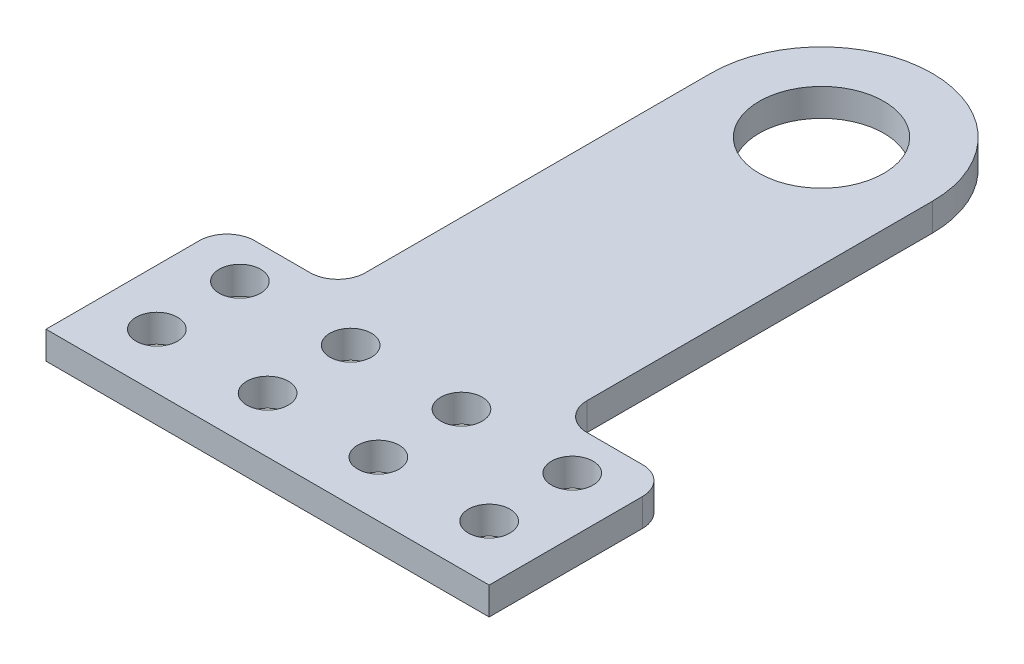
from build123d import *

# Parameters (mm, degrees)
SKETCH1_W            = 25.4
SKETCH1_H            = 41.493412961
SKETCH1_W_2          = 50.8
SKETCH1_H_2          = 110.906587039
BOSS_EXTRUDE1_DEPTH  = 6.35
SKETCH2_R            = 14.3002
CUT_EXTRUDE1_DEPTH   = 6.35
SKETCH3_R            = 4.7625
CUT_EXTRUDE2_DEPTH   = 6.35
LPATTERN1_COUNT      = 4
LPATTERN1_PITCH      = 25.4
LPATTERN1_COUNT_DIR2 = 2
LPATTERN1_PITCH_DIR2 = 19.05
FILLET1_R            = 6.35
FILLET2_R            = 25.4


with BuildPart() as part:
    # Sketch1 → Boss-Extrude1 (new body)
    with BuildSketch(Plane(origin=(0, 0, 0), x_dir=(1, 0, 0), z_dir=(0, 1, 0))):
        with Locations((-38.1, -55.45329352)):
            Rectangle(SKETCH1_W, SKETCH1_H)
        with Locations((0, -55.45329352)):
            Rectangle(SKETCH1_W_2, SKETCH1_H)
        with Locations((0, 20.746706481)):
            Rectangle(SKETCH1_W_2, SKETCH1_H_2)
        with Locations((38.1, -55.45329352)):
            Rectangle(SKETCH1_W, SKETCH1_H)
    extrude(amount=BOSS_EXTRUDE1_DEPTH)

    # Sketch2 → Cut-Extrude1 (cut)
    with BuildSketch(Plane(origin=(0, 6.35, 0), x_dir=(1, 0, 0), z_dir=(0, 1, 0))):
        with Locations(Location((0, 50.8, 0), (0, 0, 270))):
            Circle(SKETCH2_R)
    extrude(amount=-CUT_EXTRUDE1_DEPTH, mode=Mode.SUBTRACT)

    # Sketch3 → Cut-Extrude2 (cut)
    with BuildSketch(Plane(origin=(0, 6.35, 0), x_dir=(1, 0, 0), z_dir=(0, 1, 0))):
        with Locations(Location((-38.1, -63.5, 0), (0, 0, 270))):
            Circle(SKETCH3_R)
    cut_extrude2 = extrude(amount=-CUT_EXTRUDE2_DEPTH, mode=Mode.SUBTRACT)

    # LPattern1: Cut-Extrude2 4 × 2
    with Locations(*[(i * LPATTERN1_PITCH, 0, -j * LPATTERN1_PITCH_DIR2) for i in range(LPATTERN1_COUNT) for j in range(LPATTERN1_COUNT_DIR2) if (i, j) != (0, 0)]):
        add(cut_extrude2, mode=Mode.SUBTRACT)

    # Fillet1
    fillet1_edges = [part.edges().sort_by_distance(p)[0] for p in [
        (-50.8, 3.175, 34.706587039),
        (-25.4, 3.175, 34.706587039),
        (25.4, 3.175, 34.706587039),
        (50.8, 3.175, 34.706587039),
    ]]
    fillet(fillet1_edges, radius=FILLET1_R)

    # Fillet2
    fillet2_edges = [part.edges().sort_by_distance(p)[0] for p in [
        (25.4, 3.175, -76.2),
        (-25.4, 3.175, -76.2),
    ]]
    fillet(fillet2_edges, radius=FILLET2_R - 0.0001)  # a hair under: the kernel refuses the full size


solid = part.part
